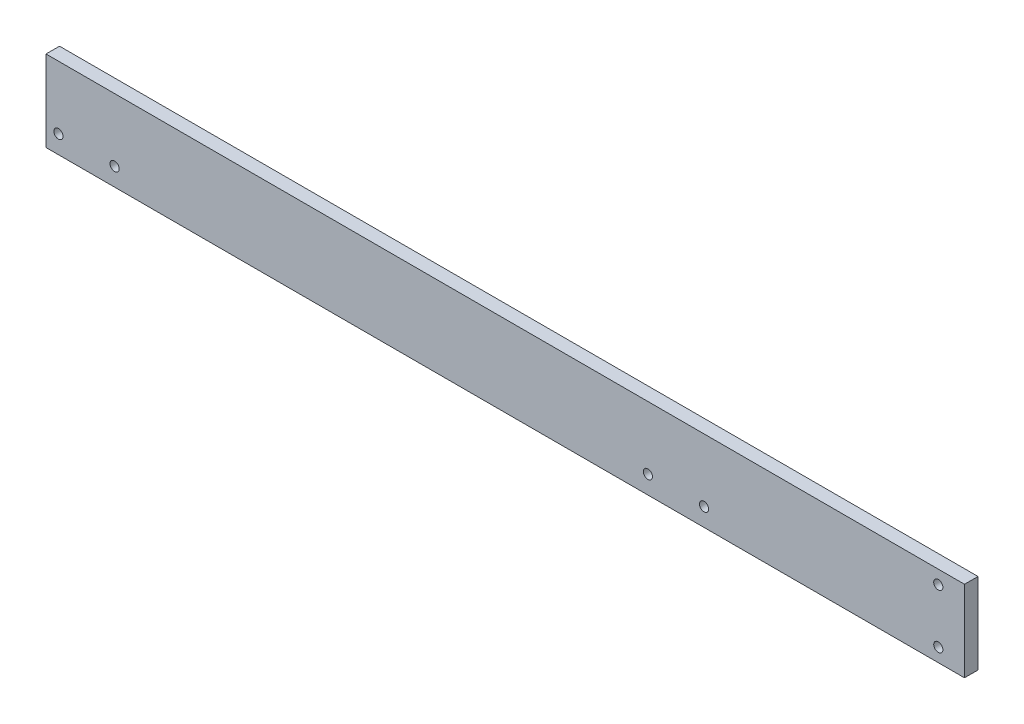
from build123d import *

# Parameters (mm, degrees)
SKETCH1_W           = 431.8
SKETCH1_H           = 38.1
BOSS_EXTRUDE1_DEPTH = 6.35
SKETCH4_R           = 2.15265
CUT_EXTRUDE2_DEPTH  = 434.524131393


with BuildPart() as part:
    # Sketch1 → Boss-Extrude1 (new body)
    with BuildSketch(Plane.XY):
        with Locations((215.9, 19.05)):
            Rectangle(SKETCH1_W, SKETCH1_H)
    extrude(amount=BOSS_EXTRUDE1_DEPTH)

    # Sketch4 → Cut-Extrude2 (cut, through all)
    with BuildSketch(Plane(origin=(0, 0, 0), x_dir=(-1, 0, 0), z_dir=(0, 0, -1))):
        with Locations((-419.481, 31.75)):
            Circle(SKETCH4_R)
        with Locations((-419.481, 6.35)):
            Circle(SKETCH4_R)
        with Locations((-309.372, 8.509)):
            Circle(SKETCH4_R)
        with Locations((-282.956, 8.509)):
            Circle(SKETCH4_R)
        with Locations((-32.258, 8.509)):
            Circle(SKETCH4_R)
        with Locations((-5.842, 8.509)):
            Circle(SKETCH4_R)
    extrude(amount=-CUT_EXTRUDE2_DEPTH, mode=Mode.SUBTRACT)


solid = part.part
